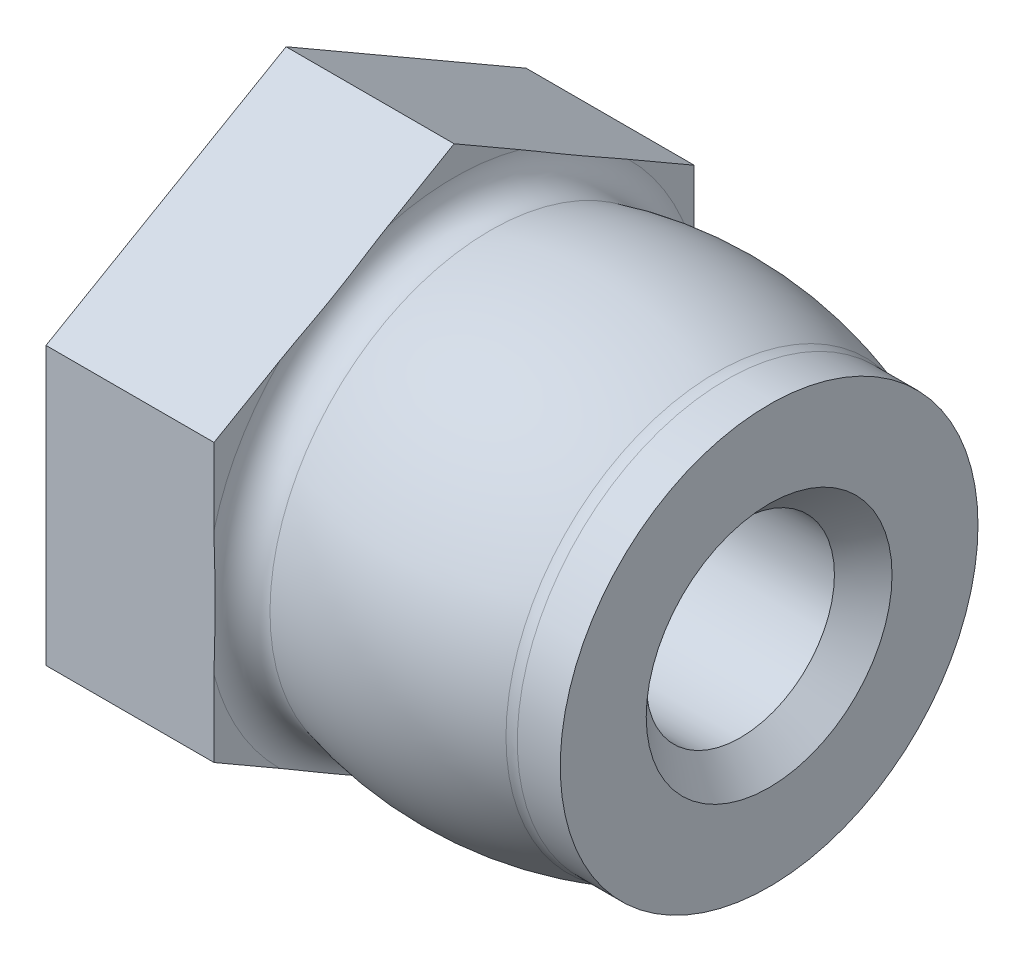
from build123d import *

# Parameters (mm, degrees)
BOSS_EXTRUDE1_START = -2.2225
SKETCH2_R           = 3.175
SKETCH2_R_2         = 1.2446
BOSS_EXTRUDE1_DEPTH = 2.2225
SKETCH3_R           = 2.76225
SKETCH3_R_2         = 1.2446
BOSS_EXTRUDE2_DEPTH = 0.635
FILLET1_R           = 0.381
FILLET2_R           = 0.381
CHAMFER1_SIZE       = 0.381


with BuildPart() as part:
    # Sketch1 → Revolve1 (revolve)
    with BuildSketch(Plane.XY, mode=Mode.PRIVATE) as revolve1_sk:
        with BuildLine():
            Line((0, 1.2446), (-5.7531, 1.2446))
            Line((-5.7531, 1.2446), (-5.7531, 3.175))
            Line((-5.7531, 3.175), (-3.5306, 3.175))
            Line((-3.5306, 3.175), (-3.5306, 2.76225))
            ThreePointArc((-3.5306, 2.76225), (-1.7653, 3.078835688), (0, 2.76225))
            Line((0, 2.76225), (0, 1.2446))
        make_face()
    revolve(revolve1_sk.sketch.rotate(Axis((-60.338913039, 0, 0), (1, 0, 0)), 90), axis=Axis((-60.338913039, 0, 0), (1, 0, 0)))

    # Sketch2 → Boss-Extrude1 (add)
    # profile 1 of 7: a face of its own
    with BuildSketch(Plane.ZY.offset(5.7531).offset(BOSS_EXTRUDE1_START)):
        with BuildLine():
            ThreePointArc((-1.587499996, 2.749630659), (1.5e-08, 3.175), (1.587500022, 2.749630644))
            Line((1.587500022, 2.749630644), (0, 3.666174209))
            Line((0, 3.666174209), (-1.587499996, 2.749630659))
        make_face()
    # profile 2 of 7: a face of its own
    with BuildSketch(Plane.ZY.offset(5.7531).offset(BOSS_EXTRUDE1_START)):
        with BuildLine():
            ThreePointArc((1.587500022, 2.749630644), (2.749630663, 1.587499989), (3.175, 0))
            Line((3.175, 0), (3.175, 1.833087105))
            Line((3.175, 1.833087105), (1.587500022, 2.749630644))
        make_face()
    # profile 3 of 7: a face of its own
    with BuildSketch(Plane.ZY.offset(5.7531).offset(BOSS_EXTRUDE1_START)):
        with BuildLine():
            Line((1.587500022, -2.749630644), (3.175, -1.833087105))
            Line((3.175, -1.833087105), (3.175, 0))
            ThreePointArc((3.175, 0), (2.749630663, -1.587499989), (1.587500022, -2.749630644))
        make_face()
    # profile 4 of 7: a face of its own
    with BuildSketch(Plane.ZY.offset(5.7531).offset(BOSS_EXTRUDE1_START)):
        with BuildLine():
            Line((0, -3.666174209), (1.587500022, -2.749630644))
            ThreePointArc((1.587500022, -2.749630644), (3.9e-08, -3.175), (-1.587499954, -2.749630684))
            Line((-1.587499954, -2.749630684), (0, -3.666174209))
        make_face()
    # profile 5 of 7: a face of its own
    with BuildSketch(Plane.ZY.offset(5.7531).offset(BOSS_EXTRUDE1_START)):
        with BuildLine():
            Line((-3.175, -1.833087105), (-1.587499954, -2.749630684))
            ThreePointArc((-1.587499954, -2.749630684), (-2.749630644, -1.587500023), (-3.175, 0))
            Line((-3.175, 0), (-3.175, -1.833087105))
        make_face()
    # profile 6 of 7: a face of its own
    with BuildSketch(Plane.ZY.offset(5.7531).offset(BOSS_EXTRUDE1_START)):
        with BuildLine():
            ThreePointArc((-3.175, 0), (-2.749630656, 1.587500002), (-1.587499996, 2.749630659))
            Line((-1.587499996, 2.749630659), (-3.175, 1.833087105))
            Line((-3.175, 1.833087105), (-3.175, 0))
        make_face()
    # profile 7 of 7: a face of its own
    with BuildSketch(Plane.ZY.offset(5.7531).offset(BOSS_EXTRUDE1_START)):
        Circle(SKETCH2_R)
        Circle(SKETCH2_R_2, mode=Mode.SUBTRACT)
    extrude(amount=BOSS_EXTRUDE1_DEPTH)

    # Sketch3 → Boss-Extrude2 (add)
    with BuildSketch(Plane(origin=(0, 0, 0), x_dir=(0, 0, -1), z_dir=(1, 0, 0))):
        Circle(SKETCH3_R)
        with Locations(Location((0, 0, 0), (0, 0, 180))):
            Circle(SKETCH3_R_2, mode=Mode.SUBTRACT)
    extrude(amount=BOSS_EXTRUDE2_DEPTH)

    # Fillet1
    # the kernel refuses this fillet: 0.381 mm, written as the material it adds along each edge
    with BuildSketch(Plane(origin=(-3.5306, 0, 0), x_dir=(0, 0, 1), z_dir=(0, 1, 0))) as fillet1_piece_1_section:
        with BuildLine():
            CenterArc((3.281470874, 0.381), FILLET1_R, 165.315967452, 104.684032548)
            Line((3.281470874, 0), (2.76225, 0))
            ThreePointArc((2.76225, 0), (2.84347095, 0.236931857), (2.912914931, 0.47757907))
        make_face()
    fillet1_piece_1 = revolve(axis=Axis((-3.5306, 0, 0), (1, 0, 0)), mode=Mode.PRIVATE)
    fillet1_piece_1 = split(fillet1_piece_1, bisect_by=Plane(origin=(-3.388915245, -4.036268752, -0.641022551), z_dir=(0, 0.8660254037844388, -0.49999999999999983)), keep=Keep.TOP, mode=Mode.PRIVATE)
    fillet1_piece_1 = split(fillet1_piece_1, bisect_by=Plane(origin=(-3.388915245, -1.462992562, -3.816022551), z_dir=(0, 0.8660254037844387, 0.5)), keep=Keep.TOP, mode=Mode.PRIVATE)
    fillet1_piece_1 = split(fillet1_piece_1, bisect_by=Plane(origin=(-3.388915245, 0, -3.175), z_dir=(0, 0, 1)), keep=Keep.TOP, mode=Mode.PRIVATE)
    fillet1_piece_1 = split(fillet1_piece_1, bisect_by=Plane(origin=(-3.388915245, 1.462992562, -3.816022551), z_dir=(0, -0.8660254037844387, 0.49999999999999994)), keep=Keep.TOP, mode=Mode.PRIVATE)
    fillet1_piece_1 = split(fillet1_piece_1, bisect_by=Plane(origin=(-3.388915245, 4.036268752, -0.641022551), z_dir=(0, -0.8660254037844387, -0.49999999999999983)), keep=Keep.TOP, mode=Mode.PRIVATE)
    fillet1_piece_1 = split(fillet1_piece_1, bisect_by=Plane(origin=(-3.388915245, 0, 3.175), z_dir=(0, 0, -1)), keep=Keep.TOP, mode=Mode.PRIVATE)
    add(fillet1_piece_1)

    # Fillet2
    fillet2_edges = [part.edges().sort_by_distance(p)[0] for p in [
        (0, -2.76225, 0),
    ]]
    fillet(fillet2_edges, radius=FILLET2_R)

    # Chamfer1
    chamfer1_edges = [part.edges().sort_by_distance(p)[0] for p in [
        (0.635, 0, -1.2446),
    ]]
    chamfer(chamfer1_edges, length=CHAMFER1_SIZE)


solid = part.part
